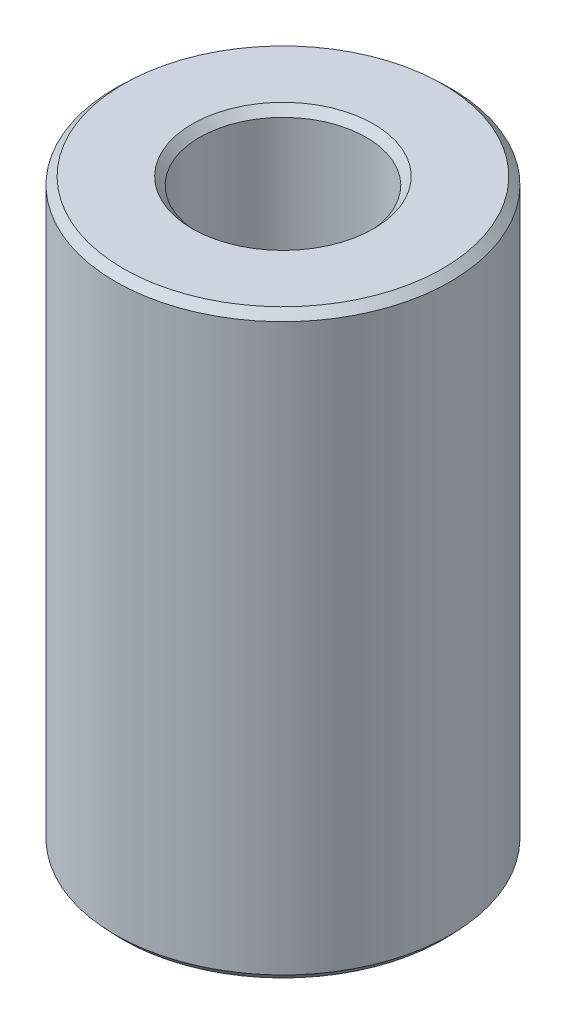
from build123d import *
from OCP.BRepFilletAPI import BRepFilletAPI_MakeChamfer

# Parameters (mm, degrees)
SKETCH1_R           = 5
BOSS_EXTRUDE1_DEPTH = 17.334557517
SKETCH2_R           = 2.486555695
CUT_EXTRUDE1_DEPTH  = 19.721294942
CHAMFER1_SIZE       = 0.220538154
CHAMFER1_SIZE2      = 0.234252562


with BuildPart() as part:
    # Sketch1 → Boss-Extrude1 (new body)
    with BuildSketch(Plane(origin=(0, 0, 0), x_dir=(1, 0, 0), z_dir=(0, 1, 0))):
        Circle(SKETCH1_R)
    extrude(amount=BOSS_EXTRUDE1_DEPTH)

    # Sketch2 → Cut-Extrude1 (cut, through all)
    with BuildSketch(Plane(origin=(0, 0, 0), x_dir=(1, 0, 0), z_dir=(0, 1, 0))):
        Circle(SKETCH2_R)
    extrude(amount=CUT_EXTRUDE1_DEPTH, mode=Mode.SUBTRACT)

    # Chamfer1: one chamfer whose edges measure the first distance from different faces: ONE call of the kernel's chamfer builder (chamfer() names one face for all edges)
    chamfer1_edges_1 = [part.edges().sort_by_distance(p)[0] for p in [
        (-2.486555695, 17.334557517, 0),
    ]]
    chamfer1_side_1 = [part.faces().sort_by_distance(p)[0] for p in [
        (-4.858578644, 17.334557517, 0),
    ]]
    chamfer1_edges_2 = [part.edges().sort_by_distance(p)[0] for p in [
        (-2.486555695, 0, 0),
    ]]
    chamfer1_side_2 = [part.faces().sort_by_distance(p)[0] for p in [
        (-2.486555695, 8.667278758, 0),
    ]]
    chamfer1_edges_3 = [part.edges().sort_by_distance(p)[0] for p in [
        (-5, 0, 0),
    ]]
    chamfer1_side_3 = [part.faces().sort_by_distance(p)[0] for p in [
        (-4.858578644, 0, 0),
    ]]
    chamfer1_edges_4 = [part.edges().sort_by_distance(p)[0] for p in [
        (-5, 17.334557517, 0),
    ]]
    chamfer1_side_4 = [part.faces().sort_by_distance(p)[0] for p in [
        (-5, 8.667278758, 0),
    ]]
    chamfer1 = BRepFilletAPI_MakeChamfer(part.part.solid().wrapped)
    for e in chamfer1_edges_1:
        chamfer1.Add(CHAMFER1_SIZE, CHAMFER1_SIZE2, e.wrapped, chamfer1_side_1[0].wrapped)  # the first distance lies on this face
    for e in chamfer1_edges_2:
        chamfer1.Add(CHAMFER1_SIZE, CHAMFER1_SIZE2, e.wrapped, chamfer1_side_2[0].wrapped)  # the first distance lies on this face
    for e in chamfer1_edges_3:
        chamfer1.Add(CHAMFER1_SIZE, CHAMFER1_SIZE2, e.wrapped, chamfer1_side_3[0].wrapped)  # the first distance lies on this face
    for e in chamfer1_edges_4:
        chamfer1.Add(CHAMFER1_SIZE, CHAMFER1_SIZE2, e.wrapped, chamfer1_side_4[0].wrapped)  # the first distance lies on this face
    add(Compound.cast(chamfer1.Shape()), mode=Mode.REPLACE)


solid = part.part
